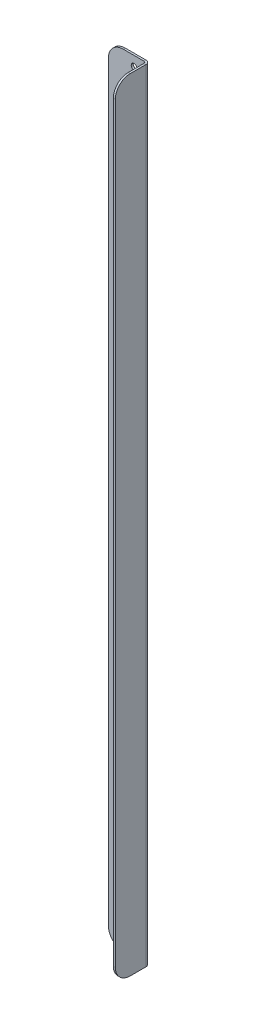
from build123d import *

# Parameters (mm, degrees)
SKETCH2_W                    = 40
SKETCH2_H                    = 792
BASE_FLANGE1_DEPTH           = 2
EDGE_FLANGE1_STRIP_W         = 12
EDGE_FLANGE1_STRIP_H         = 2
EDGE_FLANGE1_STRIP_CUT_DEPTH = 792
EDGE_FLANGE1_DEPTH           = 792
M5_CLEARANCE_HOLE1_D         = 5.8
LPATTERN1_COUNT              = 5
LPATTERN1_PITCH              = 193
FILLET1_R                    = 15


# Sheet-metal steps are written as plain solids
with BuildPart() as part:
    # Sketch2 → Base-Flange1 (new body)
    with BuildSketch(Plane.XY):
        Rectangle(SKETCH2_W, SKETCH2_H)
    extrude(amount=-BASE_FLANGE1_DEPTH)

    # Edge-Flange1 strip (across the edge) → Edge-Flange1 strip cut (cut)
    with BuildSketch(Plane(origin=(20, -396, 0), x_dir=(-1, 0, 0), z_dir=(0, 1, 0))):
        with Locations((-2, -1)):
            Rectangle(EDGE_FLANGE1_STRIP_W, EDGE_FLANGE1_STRIP_H)
    extrude(amount=EDGE_FLANGE1_STRIP_CUT_DEPTH, mode=Mode.SUBTRACT)

    # Edge-Flange1 section (across the edge) → Edge-Flange1 (add)
    with BuildSketch(Plane(origin=(20, -396, 0), x_dir=(-1, 0, 0), z_dir=(0, 1, 0))):
        with BuildLine():
            Line((0, 2), (0, 33))
            Line((0, 33), (2, 33))
            Line((2, 33), (2, 2))
            ThreePointArc((2, 2), (2.585786438, 0.585786438), (4, 0))
            Line((4, 0), (4, -2))
            ThreePointArc((4, -2), (1.171572875, -0.828427125), (0, 2))
        make_face()
    extrude(amount=EDGE_FLANGE1_DEPTH)

    # M5 Clearance Hole1 (through all)
    with Locations(Plane.XY):
        with Locations((6.0075, -386)):
            m5_clearance_hole1 = Hole(M5_CLEARANCE_HOLE1_D / 2)

    # LPattern1: M5 Clearance Hole1 ×5
    with Locations(*[(0, i * LPATTERN1_PITCH, 0) for i in range(1, LPATTERN1_COUNT)]):
        add(m5_clearance_hole1, mode=Mode.SUBTRACT)

    # Fillet1
    fillet1_edges = [part.edges().sort_by_distance(p)[0] for p in [
        (19, -396, 33),
        (19, 396, 33),
        (-20, -396, -1),
        (-20, 396, -1),
    ]]
    fillet(fillet1_edges, radius=FILLET1_R)


solid = part.part
